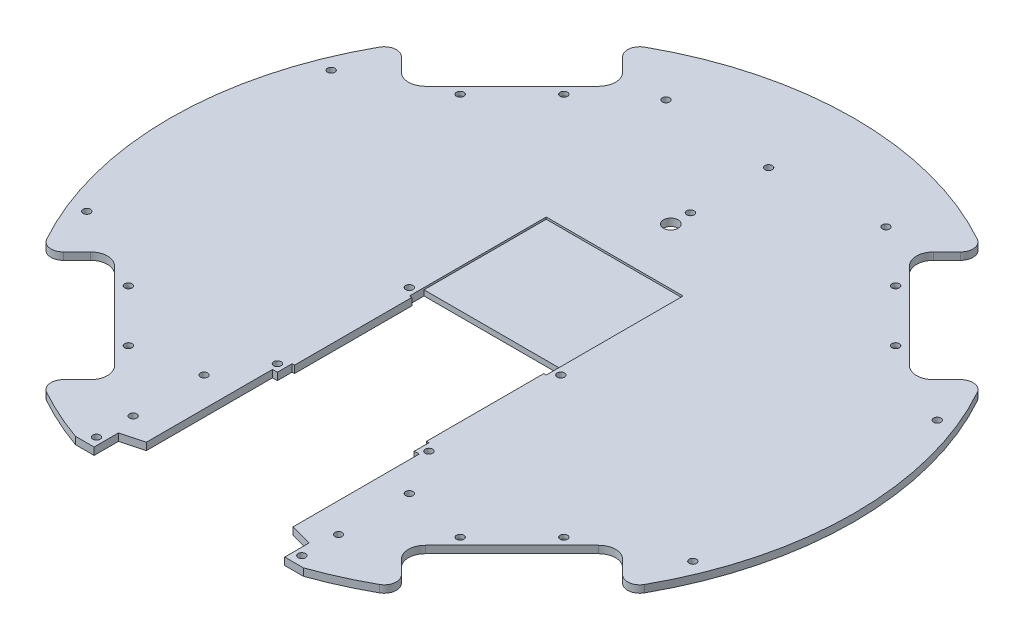
from build123d import *

# Parameters (mm, degrees)
SKETCH1_R                = 140
BOSS_EXTRUDE1_DEPTH      = 3
CUT_EXTRUDE4_REACH       = 200.013
CUT_EXTRUDE6_REACH       = 200.013
SKETCH9_R                = 1.5
FILLET1_R                = 5
CIRPATTERN1_COUNT        = 4
FILLET1_OF_CIRPATTERN1_R = 5
CUT_EXTRUDE1_REACH       = 200.013
FILLET3_R                = 1.5
CUT_EXTRUDE7_REACH       = 200.013
SKETCH10_R               = 1.5
CUT_EXTRUDE9_REACH       = 200.013
SKETCH13_R               = 1.5
CUT_EXTRUDE12_REACH      = 200.013
SKETCH16_R               = 1.5
SKETCH16_R_2             = 3
CUT_EXTRUDE13_REACH      = 200.013
SKETCH17_R               = 1.5
SKETCH18_W               = 56
SKETCH18_H               = 50
CUT_EXTRUDE14_DEPTH      = 0.8
CUT_EXTRUDE15_REACH      = 200.013
SKETCH19_R               = 1.5


with BuildPart() as part:
    # Sketch1 → Boss-Extrude1 (new body)
    with BuildSketch(Plane(origin=(0, 0, 0), x_dir=(1, 0, 0), z_dir=(0, 1, 0))):
        Circle(SKETCH1_R)
    extrude(amount=BOSS_EXTRUDE1_DEPTH)

    # Sketch7 → Cut-Extrude4 (cut, up to next)
    with BuildSketch(Plane(origin=(0, 3, 0), x_dir=(1, 0, 0), z_dir=(0, 1, 0)), mode=Mode.PRIVATE) as cut_extrude4_sk1:
        with BuildLine():
            Line((-99.030304705, -63.604254968), (-63.604254968, -99.030304705))
            ThreePointArc((-63.604254968, -99.030304705), (-61.568647097, -103.944696834), (-63.604254968, -108.859088964))
            Line((-63.604254968, -108.859088964), (-76.367532368, -121.622366364))
            Line((-76.367532368, -121.622366364), (-121.622366364, -76.367532368))
            Line((-121.622366364, -76.367532368), (-108.859088964, -63.604254968))
            ThreePointArc((-108.859088964, -63.604254968), (-103.944696834, -61.568647097), (-99.030304705, -63.604254968))
        make_face()
    cut_extrude4_tool1 = extrude(cut_extrude4_sk1.sketch, amount=-CUT_EXTRUDE4_REACH, mode=Mode.PRIVATE) & part.part
    cut_extrude4 = cut_extrude4_tool1.solids().sort_by_distance((-90.257735, 3, 90.257735))[0]
    add(cut_extrude4, mode=Mode.SUBTRACT)

    # Sketch9 → Cut-Extrude6 (cut, up to next)
    with BuildSketch(Plane(origin=(0, 3, 0), x_dir=(1, 0, 0), z_dir=(0, 1, 0)), mode=Mode.PRIVATE) as cut_extrude6_sk1:
        with Locations((-89.09545443, -67.882250994)):
            Circle(SKETCH9_R)
    cut_extrude6_tool1 = extrude(cut_extrude6_sk1.sketch, amount=-CUT_EXTRUDE6_REACH, mode=Mode.PRIVATE) & part.part
    # Sketch9 → Cut-Extrude6 (cut, up to next)
    with BuildSketch(Plane(origin=(0, 3, 0), x_dir=(1, 0, 0), z_dir=(0, 1, 0)), mode=Mode.PRIVATE) as cut_extrude6_sk2:
        with Locations((-67.882250994, -89.09545443)):
            Circle(SKETCH9_R)
    cut_extrude6_tool2 = extrude(cut_extrude6_sk2.sketch, amount=-CUT_EXTRUDE6_REACH, mode=Mode.PRIVATE) & part.part
    cut_extrude6_1 = cut_extrude6_tool1.solids().sort_by_distance((-89.095454, 3, 67.882251))[0]
    add(cut_extrude6_1, mode=Mode.SUBTRACT)
    cut_extrude6_2 = cut_extrude6_tool2.solids().sort_by_distance((-67.882251, 3, 89.095454))[0]
    add(cut_extrude6_2, mode=Mode.SUBTRACT)
    cut_extrude6 = cut_extrude6_1 + cut_extrude6_2  # Cut-Extrude6 as one shape, for the pattern or mirror that repeats it

    # Fillet1
    fillet1_edges = [part.edges().sort_by_distance(p)[0] for p in [
        (-73.746853427, 1.5, 119.001687423),
        (-119.001687423, 1.5, 73.746853427),
    ]]
    fillet(fillet1_edges, radius=FILLET1_R)

    # CirPattern1: Cut-Extrude4, Cut-Extrude6 ×4 about axis
    cirpattern1_axis = Axis((0, 3, 0), (0, 1, 0))
    add([cut_extrude4.rotate(cirpattern1_axis, i * 360 / CIRPATTERN1_COUNT) for i in range(1, CIRPATTERN1_COUNT)], mode=Mode.SUBTRACT)
    add([cut_extrude6.rotate(cirpattern1_axis, i * 360 / CIRPATTERN1_COUNT) for i in range(1, CIRPATTERN1_COUNT)], mode=Mode.SUBTRACT)

    # Fillet1 of CirPattern1
    fillet1_of_cirpattern1_edges = [part.edges().sort_by_distance(p)[0] for p in [
        (119.001687423, 1.5, 73.746853427),
        (73.746853427, 1.5, 119.001687423),
        (73.746853427, 1.5, -119.001687423),
        (119.001687423, 1.5, -73.746853427),
        (-119.001687423, 1.5, -73.746853427),
        (-73.746853427, 1.5, -119.001687423),
    ]]
    fillet(fillet1_of_cirpattern1_edges, radius=FILLET1_OF_CIRPATTERN1_R)

    # Sketch2 → Cut-Extrude1 (cut, up to next)
    with BuildSketch(Plane(origin=(0, 3, 0), x_dir=(1, 0, 0), z_dir=(0, 1, 0)), mode=Mode.PRIVATE) as cut_extrude1_sk1:
        Polygon((-46.647615159, -132), (-39, -132), (-39, -122), (-30, -119.588457268), (-30, -68), (-28, -68), (-28, -62), (-27, -62), (-27, -14), (-28, -14), (-28, -8), (28, -8), (28, -14), (27, -14), (27, -62), (28, -62), (28, -68), (30, -68), (30, -119.588457268), (39, -122), (39, -132), (46.647615159, -132), (46.647615159, -140), (-46.647615159, -140), align=None)
    cut_extrude1_tool1 = extrude(cut_extrude1_sk1.sketch, amount=-CUT_EXTRUDE1_REACH, mode=Mode.PRIVATE) & part.part
    add(cut_extrude1_tool1.solids().sort_by_distance((0, 3, 78.865183))[0], mode=Mode.SUBTRACT)

    # Fillet3
    fillet3_edges = [part.edges().sort_by_distance(p)[0] for p in [
        (67.882250994, 0, 90.59545443),
        (89.09545443, 0, 69.382250994),
        (90.59545443, 0, -67.882250994),
        (69.382250994, 0, -89.09545443),
        (-67.882250994, 0, -90.59545443),
        (-89.09545443, 0, -69.382250994),
        (-69.382250994, 0, 89.09545443),
        (-90.59545443, 0, 67.882250994),
    ]]
    fillet(fillet3_edges, radius=FILLET3_R)

    # Sketch10 → Cut-Extrude7 (cut, up to next)
    with BuildSketch(Plane(origin=(0, 3, 0), x_dir=(1, 0, 0), z_dir=(0, 1, 0)), mode=Mode.PRIVATE) as cut_extrude7_sk1:
        with Locations((-31, -65)):
            Circle(SKETCH10_R)
    cut_extrude7_tool1 = extrude(cut_extrude7_sk1.sketch, amount=-CUT_EXTRUDE7_REACH, mode=Mode.PRIVATE) & part.part
    # Sketch10 → Cut-Extrude7 (cut, up to next)
    with BuildSketch(Plane(origin=(0, 3, 0), x_dir=(1, 0, 0), z_dir=(0, 1, 0)), mode=Mode.PRIVATE) as cut_extrude7_sk2:
        with Locations((31, -65)):
            Circle(SKETCH10_R)
    cut_extrude7_tool2 = extrude(cut_extrude7_sk2.sketch, amount=-CUT_EXTRUDE7_REACH, mode=Mode.PRIVATE) & part.part
    # Sketch10 → Cut-Extrude7 (cut, up to next)
    with BuildSketch(Plane(origin=(0, 3, 0), x_dir=(1, 0, 0), z_dir=(0, 1, 0)), mode=Mode.PRIVATE) as cut_extrude7_sk3:
        with Locations((-31, -11)):
            Circle(SKETCH10_R)
    cut_extrude7_tool3 = extrude(cut_extrude7_sk3.sketch, amount=-CUT_EXTRUDE7_REACH, mode=Mode.PRIVATE) & part.part
    # Sketch10 → Cut-Extrude7 (cut, up to next)
    with BuildSketch(Plane(origin=(0, 3, 0), x_dir=(1, 0, 0), z_dir=(0, 1, 0)), mode=Mode.PRIVATE) as cut_extrude7_sk4:
        with Locations((31, -11)):
            Circle(SKETCH10_R)
    cut_extrude7_tool4 = extrude(cut_extrude7_sk4.sketch, amount=-CUT_EXTRUDE7_REACH, mode=Mode.PRIVATE) & part.part
    add(cut_extrude7_tool1.solids().sort_by_distance((-31, 3, 65))[0], mode=Mode.SUBTRACT)
    add(cut_extrude7_tool2.solids().sort_by_distance((31, 3, 65))[0], mode=Mode.SUBTRACT)
    add(cut_extrude7_tool3.solids().sort_by_distance((-31, 3, 11))[0], mode=Mode.SUBTRACT)
    add(cut_extrude7_tool4.solids().sort_by_distance((31, 3, 11))[0], mode=Mode.SUBTRACT)

    # Sketch13 → Cut-Extrude9 (cut, up to next)
    with BuildSketch(Plane(origin=(0, 3, 0), x_dir=(1, 0, 0), z_dir=(0, 1, 0)), mode=Mode.PRIVATE) as cut_extrude9_sk1:
        with Locations((-42, -84)):
            Circle(SKETCH13_R)
    cut_extrude9_tool1 = extrude(cut_extrude9_sk1.sketch, amount=-CUT_EXTRUDE9_REACH, mode=Mode.PRIVATE) & part.part
    # Sketch13 → Cut-Extrude9 (cut, up to next)
    with BuildSketch(Plane(origin=(0, 3, 0), x_dir=(1, 0, 0), z_dir=(0, 1, 0)), mode=Mode.PRIVATE) as cut_extrude9_sk2:
        with Locations((-42, -113)):
            Circle(SKETCH13_R)
    cut_extrude9_tool2 = extrude(cut_extrude9_sk2.sketch, amount=-CUT_EXTRUDE9_REACH, mode=Mode.PRIVATE) & part.part
    # Sketch13 → Cut-Extrude9 (cut, up to next)
    with BuildSketch(Plane(origin=(0, 3, 0), x_dir=(1, 0, 0), z_dir=(0, 1, 0)), mode=Mode.PRIVATE) as cut_extrude9_sk3:
        with Locations((42, -113)):
            Circle(SKETCH13_R)
    cut_extrude9_tool3 = extrude(cut_extrude9_sk3.sketch, amount=-CUT_EXTRUDE9_REACH, mode=Mode.PRIVATE) & part.part
    # Sketch13 → Cut-Extrude9 (cut, up to next)
    with BuildSketch(Plane(origin=(0, 3, 0), x_dir=(1, 0, 0), z_dir=(0, 1, 0)), mode=Mode.PRIVATE) as cut_extrude9_sk4:
        with Locations((42, -84)):
            Circle(SKETCH13_R)
    cut_extrude9_tool4 = extrude(cut_extrude9_sk4.sketch, amount=-CUT_EXTRUDE9_REACH, mode=Mode.PRIVATE) & part.part
    add(cut_extrude9_tool1.solids().sort_by_distance((-42, 3, 84))[0], mode=Mode.SUBTRACT)
    add(cut_extrude9_tool2.solids().sort_by_distance((-42, 3, 113))[0], mode=Mode.SUBTRACT)
    add(cut_extrude9_tool3.solids().sort_by_distance((42, 3, 113))[0], mode=Mode.SUBTRACT)
    add(cut_extrude9_tool4.solids().sort_by_distance((42, 3, 84))[0], mode=Mode.SUBTRACT)

    # Sketch16 → Cut-Extrude12 (cut, up to next)
    with BuildSketch(Plane(origin=(0, 3, 0), x_dir=(1, 0, 0), z_dir=(0, 1, 0)), mode=Mode.PRIVATE) as cut_extrude12_sk1:
        with Locations((0, 73)):
            Circle(SKETCH16_R)
    cut_extrude12_tool1 = extrude(cut_extrude12_sk1.sketch, amount=-CUT_EXTRUDE12_REACH, mode=Mode.PRIVATE) & part.part
    # Sketch16 → Cut-Extrude12 (cut, up to next)
    with BuildSketch(Plane(origin=(0, 3, 0), x_dir=(1, 0, 0), z_dir=(0, 1, 0)), mode=Mode.PRIVATE) as cut_extrude12_sk2:
        with Locations((-45, 108)):
            Circle(SKETCH16_R)
    cut_extrude12_tool2 = extrude(cut_extrude12_sk2.sketch, amount=-CUT_EXTRUDE12_REACH, mode=Mode.PRIVATE) & part.part
    # Sketch16 → Cut-Extrude12 (cut, up to next)
    with BuildSketch(Plane(origin=(0, 3, 0), x_dir=(1, 0, 0), z_dir=(0, 1, 0)), mode=Mode.PRIVATE) as cut_extrude12_sk3:
        with Locations((45, 108)):
            Circle(SKETCH16_R)
    cut_extrude12_tool3 = extrude(cut_extrude12_sk3.sketch, amount=-CUT_EXTRUDE12_REACH, mode=Mode.PRIVATE) & part.part
    # Sketch16 → Cut-Extrude12 (cut, up to next)
    with BuildSketch(Plane(origin=(0, 3, 0), x_dir=(1, 0, 0), z_dir=(0, 1, 0)), mode=Mode.PRIVATE) as cut_extrude12_sk4:
        with Locations((0, 105)):
            Circle(SKETCH16_R)
    cut_extrude12_tool4 = extrude(cut_extrude12_sk4.sketch, amount=-CUT_EXTRUDE12_REACH, mode=Mode.PRIVATE) & part.part
    # Sketch16 → Cut-Extrude12 (cut, up to next)
    with BuildSketch(Plane(origin=(0, 3, 0), x_dir=(1, 0, 0), z_dir=(0, 1, 0)), mode=Mode.PRIVATE) as cut_extrude12_sk5:
        with Locations((0, 65)):
            Circle(SKETCH16_R_2)
    cut_extrude12_tool5 = extrude(cut_extrude12_sk5.sketch, amount=-CUT_EXTRUDE12_REACH, mode=Mode.PRIVATE) & part.part
    add(cut_extrude12_tool1.solids().sort_by_distance((0, 3, -73))[0], mode=Mode.SUBTRACT)
    add(cut_extrude12_tool2.solids().sort_by_distance((-45, 3, -108))[0], mode=Mode.SUBTRACT)
    add(cut_extrude12_tool3.solids().sort_by_distance((45, 3, -108))[0], mode=Mode.SUBTRACT)
    add(cut_extrude12_tool4.solids().sort_by_distance((0, 3, -105))[0], mode=Mode.SUBTRACT)
    add(cut_extrude12_tool5.solids().sort_by_distance((0, 3, -65))[0], mode=Mode.SUBTRACT)

    # Sketch17 → Cut-Extrude13 (cut, up to next)
    with BuildSketch(Plane(origin=(0, 3, 0), x_dir=(1, 0, 0), z_dir=(0, 1, 0)), mode=Mode.PRIVATE) as cut_extrude13_sk1:
        with Locations((-124, 50)):
            Circle(SKETCH17_R)
    cut_extrude13_tool1 = extrude(cut_extrude13_sk1.sketch, amount=-CUT_EXTRUDE13_REACH, mode=Mode.PRIVATE) & part.part
    # Sketch17 → Cut-Extrude13 (cut, up to next)
    with BuildSketch(Plane(origin=(0, 3, 0), x_dir=(1, 0, 0), z_dir=(0, 1, 0)), mode=Mode.PRIVATE) as cut_extrude13_sk2:
        with Locations((-124, -50)):
            Circle(SKETCH17_R)
    cut_extrude13_tool2 = extrude(cut_extrude13_sk2.sketch, amount=-CUT_EXTRUDE13_REACH, mode=Mode.PRIVATE) & part.part
    # Sketch17 → Cut-Extrude13 (cut, up to next)
    with BuildSketch(Plane(origin=(0, 3, 0), x_dir=(1, 0, 0), z_dir=(0, 1, 0)), mode=Mode.PRIVATE) as cut_extrude13_sk3:
        with Locations((124, 50)):
            Circle(SKETCH17_R)
    cut_extrude13_tool3 = extrude(cut_extrude13_sk3.sketch, amount=-CUT_EXTRUDE13_REACH, mode=Mode.PRIVATE) & part.part
    # Sketch17 → Cut-Extrude13 (cut, up to next)
    with BuildSketch(Plane(origin=(0, 3, 0), x_dir=(1, 0, 0), z_dir=(0, 1, 0)), mode=Mode.PRIVATE) as cut_extrude13_sk4:
        with Locations((124, -50)):
            Circle(SKETCH17_R)
    cut_extrude13_tool4 = extrude(cut_extrude13_sk4.sketch, amount=-CUT_EXTRUDE13_REACH, mode=Mode.PRIVATE) & part.part
    add(cut_extrude13_tool1.solids().sort_by_distance((-124, 3, -50))[0], mode=Mode.SUBTRACT)
    add(cut_extrude13_tool2.solids().sort_by_distance((-124, 3, 50))[0], mode=Mode.SUBTRACT)
    add(cut_extrude13_tool3.solids().sort_by_distance((124, 3, -50))[0], mode=Mode.SUBTRACT)
    add(cut_extrude13_tool4.solids().sort_by_distance((124, 3, 50))[0], mode=Mode.SUBTRACT)

    # Sketch18 → Cut-Extrude14 (cut)
    with BuildSketch(Plane(origin=(0, 3, 0), x_dir=(1, 0, 0), z_dir=(0, 1, 0))):
        with Locations((0, 17)):
            Rectangle(SKETCH18_W, SKETCH18_H)
    extrude(amount=-CUT_EXTRUDE14_DEPTH, mode=Mode.SUBTRACT)

    # Sketch19 → Cut-Extrude15 (cut, up to next)
    with BuildSketch(Plane(origin=(0, 3, 0), x_dir=(1, 0, 0), z_dir=(0, 1, 0)), mode=Mode.PRIVATE) as cut_extrude15_sk1:
        with Locations((-42, -128)):
            Circle(SKETCH19_R)
    cut_extrude15_tool1 = extrude(cut_extrude15_sk1.sketch, amount=-CUT_EXTRUDE15_REACH, mode=Mode.PRIVATE) & part.part
    # Sketch19 → Cut-Extrude15 (cut, up to next)
    with BuildSketch(Plane(origin=(0, 3, 0), x_dir=(1, 0, 0), z_dir=(0, 1, 0)), mode=Mode.PRIVATE) as cut_extrude15_sk2:
        with Locations((42, -128)):
            Circle(SKETCH19_R)
    cut_extrude15_tool2 = extrude(cut_extrude15_sk2.sketch, amount=-CUT_EXTRUDE15_REACH, mode=Mode.PRIVATE) & part.part
    add(cut_extrude15_tool1.solids().sort_by_distance((-42, 3, 128))[0], mode=Mode.SUBTRACT)
    add(cut_extrude15_tool2.solids().sort_by_distance((42, 3, 128))[0], mode=Mode.SUBTRACT)


solid = part.part
